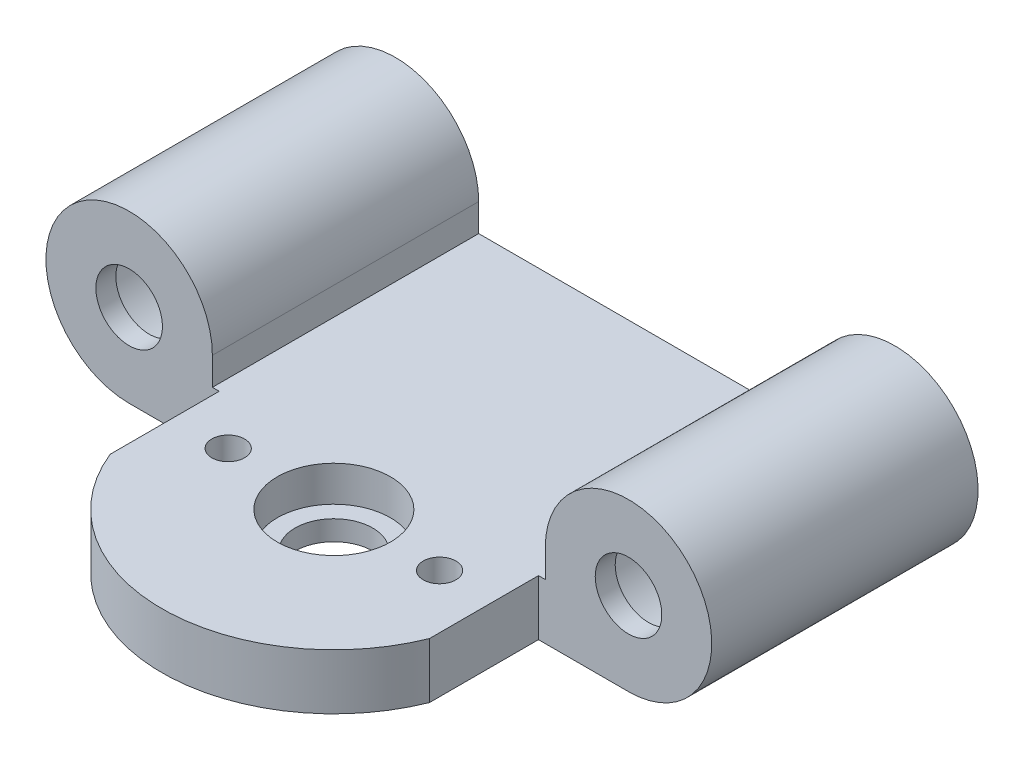
from build123d import *

# Parameters (mm, degrees)
ESQUISSE1_R             = 3.5
BOSS_EXTRU_1_DEPTH      = 5
ESQUISSE2_R             = 5.1
ENL_V_MAT_EXTRU_1_DEPTH = 3.2
ESQUISSE3_R             = 1.475
ENL_V_MAT_EXTRU_2_DEPTH = 4
ESQUISSE4_R             = 3
BOSS_EXTRU_2_DEPTH      = 24
ESQUISSE5_R             = 6.1
ENL_V_MAT_EXTRU_3_DEPTH = 22.2


with BuildPart() as part:
    # Esquisse1 → Boss.-Extru.1 (new body)
    with BuildSketch(Plane(origin=(0, 0, 0), x_dir=(1, 0, 0), z_dir=(0, 1, 0))):
        with BuildLine():
            Line((-14.385, -5.772501624), (-14.385, 28.05))
            Line((-14.385, 28.05), (14.385, 28.05))
            Line((14.385, 28.05), (14.385, -5.772501624))
            ThreePointArc((14.385, -5.772501624), (0, -15.5), (-14.385, -5.772501624))
        make_face()
        Circle(ESQUISSE1_R, mode=Mode.SUBTRACT)
    extrude(amount=BOSS_EXTRU_1_DEPTH)

    # Esquisse2 → Enlèv. mat.-Extru.1 (cut)
    with BuildSketch(Plane(origin=(0, 5, 0), x_dir=(1, 0, 0), z_dir=(0, 1, 0))):
        Circle(ESQUISSE2_R)
    extrude(amount=-ENL_V_MAT_EXTRU_1_DEPTH, mode=Mode.SUBTRACT)

    # Esquisse3 → Enlèv. mat.-Extru.2 (cut)
    with BuildSketch(Plane(origin=(0, 5, 0), x_dir=(1, 0, 0), z_dir=(0, 1, 0))):
        with Locations((-9.525, 0)):
            Circle(ESQUISSE3_R)
        with Locations((9.525, 0)):
            Circle(ESQUISSE3_R)
    extrude(amount=-ENL_V_MAT_EXTRU_2_DEPTH, mode=Mode.SUBTRACT)

    # Esquisse4 → Boss.-Extru.2 (add)
    # profile 1 of 2: a face of its own
    with BuildSketch(Plane(origin=(0, 0, -28.05), x_dir=(-1, 0, 0), z_dir=(0, 0, -1))):
        with BuildLine():
            Line((-22.5, 0), (-14.385, 0))
            Line((-14.385, 0), (-14.385, 5))
            Line((-14.385, 5), (-15, 5))
            Line((-15, 5), (-15, 7.5))
            ThreePointArc((-15, 7.5), (-27.803300859, 12.803300859), (-22.5, 0))
        make_face()
        with Locations((-22.5, 7.5)):
            Circle(ESQUISSE4_R, mode=Mode.SUBTRACT)
    # profile 2 of 2: a face of its own
    with BuildSketch(Plane(origin=(0, 0, -28.05), x_dir=(-1, 0, 0), z_dir=(0, 0, -1))):
        with BuildLine():
            Line((14.385, 5), (14.385, 0))
            Line((14.385, 0), (22.5, 0))
            ThreePointArc((22.5, 0), (27.803300859, 12.803300859), (15, 7.5))
            Line((15, 7.5), (15, 5))
            Line((15, 5), (14.385, 5))
        make_face()
        with Locations((22.5, 7.5)):
            Circle(ESQUISSE4_R, mode=Mode.SUBTRACT)
    extrude(amount=-BOSS_EXTRU_2_DEPTH)

    # Esquisse5 → Enlèv. mat.-Extru.3 (cut)
    with BuildSketch(Plane(origin=(0, 0, -28.05), x_dir=(-1, 0, 0), z_dir=(0, 0, -1))):
        with Locations((22.5, 7.5)):
            Circle(ESQUISSE5_R)
        with Locations((-22.5, 7.5)):
            Circle(ESQUISSE5_R)
    extrude(amount=-ENL_V_MAT_EXTRU_3_DEPTH, mode=Mode.SUBTRACT)


solid = part.part
